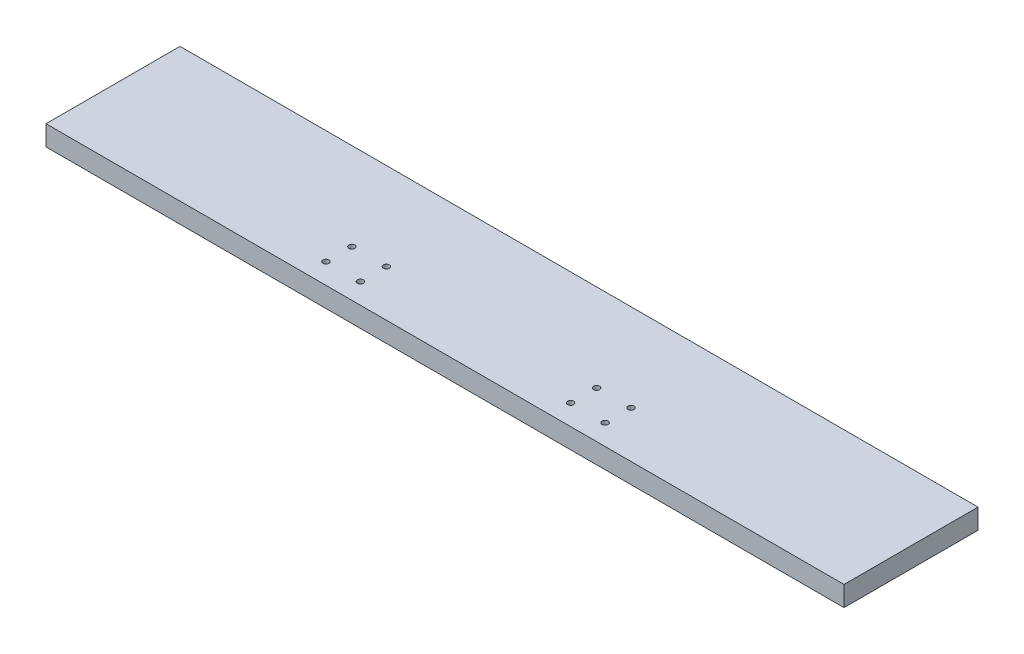
from build123d import *

# Parameters (mm, degrees)
SKETCH2_W           = 756.412
SKETCH2_H           = 127
BOSS_EXTRUDE1_DEPTH = 19.05
CUT_EXTRUDE1_REACH  = 769.236
SKETCH3_R           = 2.85115


with BuildPart() as part:
    # Sketch2 → Boss-Extrude1 (new body)
    with BuildSketch(Plane(origin=(0, 0, 0), x_dir=(1, 0, 0), z_dir=(0, 1, 0))):
        with Locations((378.206, 63.5)):
            Rectangle(SKETCH2_W, SKETCH2_H)
    extrude(amount=BOSS_EXTRUDE1_DEPTH)

    # Sketch3 → Cut-Extrude1 (cut, up to next)
    with BuildSketch(Plane(origin=(0, 19.05, 0), x_dir=(1, 0, 0), z_dir=(0, 1, 0)), mode=Mode.PRIVATE) as cut_extrude1_sk1:
        with Locations((245.92915, 19.46275)):
            Circle(SKETCH3_R)
    cut_extrude1_tool1 = extrude(cut_extrude1_sk1.sketch, amount=-CUT_EXTRUDE1_REACH, mode=Mode.PRIVATE) & part.part
    # Sketch3 → Cut-Extrude1 (cut, up to next)
    with BuildSketch(Plane(origin=(0, 19.05, 0), x_dir=(1, 0, 0), z_dir=(0, 1, 0)), mode=Mode.PRIVATE) as cut_extrude1_sk2:
        with Locations((278.58085, 19.46275)):
            Circle(SKETCH3_R)
    cut_extrude1_tool2 = extrude(cut_extrude1_sk2.sketch, amount=-CUT_EXTRUDE1_REACH, mode=Mode.PRIVATE) & part.part
    # Sketch3 → Cut-Extrude1 (cut, up to next)
    with BuildSketch(Plane(origin=(0, 19.05, 0), x_dir=(1, 0, 0), z_dir=(0, 1, 0)), mode=Mode.PRIVATE) as cut_extrude1_sk3:
        with Locations((278.58085, 44.03725)):
            Circle(SKETCH3_R)
    cut_extrude1_tool3 = extrude(cut_extrude1_sk3.sketch, amount=-CUT_EXTRUDE1_REACH, mode=Mode.PRIVATE) & part.part
    # Sketch3 → Cut-Extrude1 (cut, up to next)
    with BuildSketch(Plane(origin=(0, 19.05, 0), x_dir=(1, 0, 0), z_dir=(0, 1, 0)), mode=Mode.PRIVATE) as cut_extrude1_sk4:
        with Locations((245.92915, 44.03725)):
            Circle(SKETCH3_R)
    cut_extrude1_tool4 = extrude(cut_extrude1_sk4.sketch, amount=-CUT_EXTRUDE1_REACH, mode=Mode.PRIVATE) & part.part
    # Sketch3 → Cut-Extrude1 (cut, up to next)
    with BuildSketch(Plane(origin=(0, 19.05, 0), x_dir=(1, 0, 0), z_dir=(0, 1, 0)), mode=Mode.PRIVATE) as cut_extrude1_sk5:
        with Locations((477.83115, 19.46275)):
            Circle(SKETCH3_R)
    cut_extrude1_tool5 = extrude(cut_extrude1_sk5.sketch, amount=-CUT_EXTRUDE1_REACH, mode=Mode.PRIVATE) & part.part
    # Sketch3 → Cut-Extrude1 (cut, up to next)
    with BuildSketch(Plane(origin=(0, 19.05, 0), x_dir=(1, 0, 0), z_dir=(0, 1, 0)), mode=Mode.PRIVATE) as cut_extrude1_sk6:
        with Locations((510.48285, 19.46275)):
            Circle(SKETCH3_R)
    cut_extrude1_tool6 = extrude(cut_extrude1_sk6.sketch, amount=-CUT_EXTRUDE1_REACH, mode=Mode.PRIVATE) & part.part
    # Sketch3 → Cut-Extrude1 (cut, up to next)
    with BuildSketch(Plane(origin=(0, 19.05, 0), x_dir=(1, 0, 0), z_dir=(0, 1, 0)), mode=Mode.PRIVATE) as cut_extrude1_sk7:
        with Locations((510.48285, 44.03725)):
            Circle(SKETCH3_R)
    cut_extrude1_tool7 = extrude(cut_extrude1_sk7.sketch, amount=-CUT_EXTRUDE1_REACH, mode=Mode.PRIVATE) & part.part
    # Sketch3 → Cut-Extrude1 (cut, up to next)
    with BuildSketch(Plane(origin=(0, 19.05, 0), x_dir=(1, 0, 0), z_dir=(0, 1, 0)), mode=Mode.PRIVATE) as cut_extrude1_sk8:
        with Locations((477.83115, 44.03725)):
            Circle(SKETCH3_R)
    cut_extrude1_tool8 = extrude(cut_extrude1_sk8.sketch, amount=-CUT_EXTRUDE1_REACH, mode=Mode.PRIVATE) & part.part
    add(cut_extrude1_tool1.solids().sort_by_distance((245.92915, 19.05, -19.46275))[0], mode=Mode.SUBTRACT)
    add(cut_extrude1_tool2.solids().sort_by_distance((278.58085, 19.05, -19.46275))[0], mode=Mode.SUBTRACT)
    add(cut_extrude1_tool3.solids().sort_by_distance((278.58085, 19.05, -44.03725))[0], mode=Mode.SUBTRACT)
    add(cut_extrude1_tool4.solids().sort_by_distance((245.92915, 19.05, -44.03725))[0], mode=Mode.SUBTRACT)
    add(cut_extrude1_tool5.solids().sort_by_distance((477.83115, 19.05, -19.46275))[0], mode=Mode.SUBTRACT)
    add(cut_extrude1_tool6.solids().sort_by_distance((510.48285, 19.05, -19.46275))[0], mode=Mode.SUBTRACT)
    add(cut_extrude1_tool7.solids().sort_by_distance((510.48285, 19.05, -44.03725))[0], mode=Mode.SUBTRACT)
    add(cut_extrude1_tool8.solids().sort_by_distance((477.83115, 19.05, -44.03725))[0], mode=Mode.SUBTRACT)


solid = part.part
